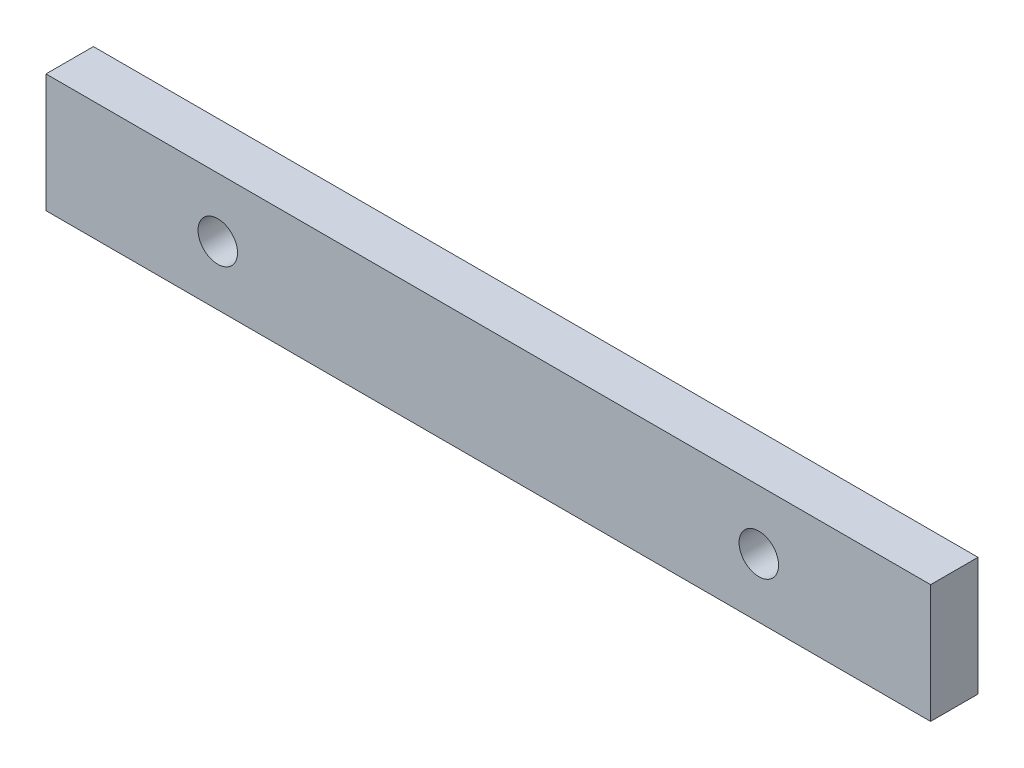
from build123d import *

# Parameters (mm, degrees)
SKETCH_1_W             = 224
SKETCH_1_H             = 30
EXTRUDE_1_DEPTH        = 12
SKETCH_4_R             = 5
CUT_EXTRUDE_1_DEPTH    = 227.318359839
PATTERN_LINEAR_1_COUNT = 2
PATTERN_LINEAR_1_PITCH = 137


with BuildPart() as part:
    # Sketch 1 → Бобышка-Вытянуть1 (new body)
    with BuildSketch(Plane.XY):
        with Locations((112, 15)):
            Rectangle(SKETCH_1_W, SKETCH_1_H)
    extrude(amount=EXTRUDE_1_DEPTH)

    # Эскиз4 → Вырез-Вытянуть1 (cut, symmetric)
    with BuildSketch(Plane.XY.offset(12)):
        with Locations((43.5, 15)):
            Circle(SKETCH_4_R)
    cut_extrude_1 = extrude(amount=CUT_EXTRUDE_1_DEPTH, both=True, mode=Mode.SUBTRACT)

    # Линейный массив1: Вырез-Вытянуть1 ×2
    with Locations(*[(i * PATTERN_LINEAR_1_PITCH, 0, 0) for i in range(1, PATTERN_LINEAR_1_COUNT)]):
        add(cut_extrude_1, mode=Mode.SUBTRACT)


solid = part.part
